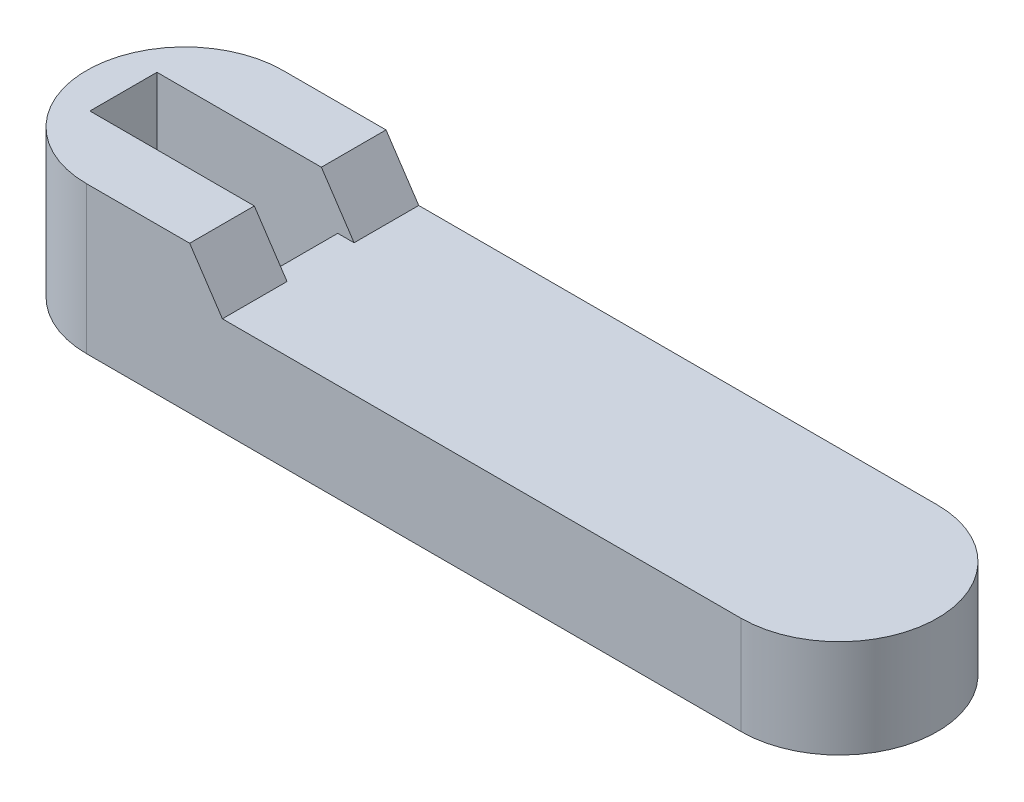
from build123d import *

# Parameters (mm, degrees)
BOSS_EXTRUDE1_DEPTH = 30
SKETCH2_R           = 7
CUT_EXTRUDE1_DEPTH  = 240.582971014
CUT_EXTRUDE2_DEPTH  = 28.5
BOSS_EXTRUDE2_DEPTH = 15
CUT_EXTRUDE3_DEPTH  = 242.919408068
CAVITY1_START       = -1
CAVITY1_OUTLINE_R   = 1.02
CAVITY1_DEPTH       = 5.98
CAVITY1_START_2     = 2.94
CAVITY1_2_OUTLINE_R = 1.683
CAVITY1_2_DEPTH     = 2.04
CAVITY1_START_3     = 4.98
CAVITY1_3_OUTLINE_R = 2.805
CAVITY1_3_DEPTH     = 1.02
SKETCH6_R           = 1.02
SKETCH6_R_2         = 5.61
CUT_EXTRUDE4_DEPTH  = 4.98
CUT_EXTRUDE5_START  = -1.02
SKETCH7_R           = 2.805
CUT_EXTRUDE5_DEPTH  = 1.02


with BuildPart() as part:
    # Sketch1 → Boss-Extrude1 (new body)
    with BuildSketch(Plane(origin=(0, 0, 0), x_dir=(1, 0, 0), z_dir=(0, 1, 0))):
        with BuildLine():
            Line((0, 0), (200, 0))
            ThreePointArc((200, 0), (230, 30), (200, 60))
            Line((200, 60), (0, 60))
            ThreePointArc((0, 60), (-30, 30), (0, 0))
        make_face()
    extrude(amount=BOSS_EXTRUDE1_DEPTH)

    # Sketch2 → Cut-Extrude1 (cut, through all)
    with BuildSketch(Plane(origin=(0, 30, 0), x_dir=(1, 0, 0), z_dir=(0, 1, 0))):
        with Locations(Location((0, 30, 0), (0, 0, 270))):
            Circle(SKETCH2_R)
    extrude(amount=-CUT_EXTRUDE1_DEPTH, mode=Mode.SUBTRACT)

    # Sketch3 → Cut-Extrude2 (cut)
    with BuildSketch(Plane(origin=(0, 30, 0), x_dir=(1, 0, 0), z_dir=(0, 1, 0))):
        Polygon((-18.75, 40.25), (-18.75, 19.75), (0, 19.75), (36.5, 19.75), (36.5, 40.25), (0, 40.25), align=None)
    extrude(amount=-CUT_EXTRUDE2_DEPTH, mode=Mode.SUBTRACT)

    # Sketch4 → Boss-Extrude2 (add)
    with BuildSketch(Plane(origin=(0, 30, 0), x_dir=(1, 0, 0), z_dir=(0, 1, 0))):
        with BuildLine():
            Line((-18.75, 40.25), (41.5, 40.25))
            Line((41.5, 40.25), (41.5, 60))
            Line((41.5, 60), (0, 60))
            ThreePointArc((0, 60), (-30, 30), (0, 0))
            Line((0, 0), (41.5, 0))
            Line((41.5, 0), (41.5, 19.75))
            Line((41.5, 19.75), (-18.75, 19.75))
            Line((-18.75, 19.75), (-18.75, 40.25))
        make_face()
    extrude(amount=BOSS_EXTRUDE2_DEPTH)

    # Sketch5 → Cut-Extrude3 (cut, through all)
    with BuildSketch(Plane.XY):
        Polygon((31.5, 45), (41.5, 45), (41.5, 30), align=None)
    extrude(amount=-CUT_EXTRUDE3_DEPTH, mode=Mode.SUBTRACT)

    # Cavity1: read off the stored shape, not the designer's step
    # Cavity1 outline → Cavity1 (cut)
    with BuildSketch(Plane(origin=(0, 0, 0), x_dir=(1, 0, 0), z_dir=(0, 1, 0)).offset(CAVITY1_START)):
        with BuildLine():
            Line((215.425139365, 48.931566971), (202.412835688, 39.121263561))
            ThreePointArc((202.412835688, 39.121263561), (200.117760104, 39.434265078), (197.815586916, 39.178647203))
            Line((197.815586916, 39.178647203), (185.052206965, 49.310687088))
            ThreePointArc((185.052206965, 49.310687088), (181.349681661, 49.121796309), (181.068433029, 45.425139365))
            Line((181.068433029, 45.425139365), (190.878736439, 32.412835688))
            ThreePointArc((190.878736439, 32.412835688), (190.565734922, 30.117760104), (190.821352797, 27.815586916))
            Line((190.821352797, 27.815586916), (180.689312912, 15.052206965))
            ThreePointArc((180.689312912, 15.052206965), (180.878203691, 11.349681661), (184.574860635, 11.068433029))
            Line((184.574860635, 11.068433029), (197.587164312, 20.878736439))
            ThreePointArc((197.587164312, 20.878736439), (199.882239896, 20.565734922), (202.184413084, 20.821352797))
            Line((202.184413084, 20.821352797), (214.947793035, 10.689312912))
            ThreePointArc((214.947793035, 10.689312912), (218.650318339, 10.878203691), (218.931566971, 14.574860635))
            Line((218.931566971, 14.574860635), (209.121263561, 27.587164312))
            ThreePointArc((209.121263561, 27.587164312), (209.434265078, 29.882239896), (209.178647203, 32.184413084))
            Line((209.178647203, 32.184413084), (219.310687088, 44.947793035))
            ThreePointArc((219.310687088, 44.947793035), (219.121796309, 48.650318339), (215.425139365, 48.931566971))
        make_face()
        with Locations((183.022971201, 13.441566555)):
            Circle(CAVITY1_OUTLINE_R, mode=Mode.SUBTRACT)
        with Locations((186.673945136, 17.002519984)):
            Circle(CAVITY1_OUTLINE_R, mode=Mode.SUBTRACT)
        with Locations((190.324919072, 20.563473413)):
            Circle(CAVITY1_OUTLINE_R, mode=Mode.SUBTRACT)
        with Locations((193.975893007, 24.124426842)):
            Circle(CAVITY1_OUTLINE_R, mode=Mode.SUBTRACT)
        with Locations((216.558433445, 13.022971201)):
            Circle(CAVITY1_OUTLINE_R, mode=Mode.SUBTRACT)
        with Locations((212.997480016, 16.673945136)):
            Circle(CAVITY1_OUTLINE_R, mode=Mode.SUBTRACT)
        with Locations((209.436526587, 20.324919072)):
            Circle(CAVITY1_OUTLINE_R, mode=Mode.SUBTRACT)
        with Locations((205.875573158, 23.975893007)):
            Circle(CAVITY1_OUTLINE_R, mode=Mode.SUBTRACT)
        with Locations((194.124426842, 36.024106993)):
            Circle(CAVITY1_OUTLINE_R, mode=Mode.SUBTRACT)
        with Locations((190.563473413, 39.675080928)):
            Circle(CAVITY1_OUTLINE_R, mode=Mode.SUBTRACT)
        with Locations((187.002519984, 43.326054864)):
            Circle(CAVITY1_OUTLINE_R, mode=Mode.SUBTRACT)
        with Locations((183.441566555, 46.977028799)):
            Circle(CAVITY1_OUTLINE_R, mode=Mode.SUBTRACT)
        with BuildLine():
            Line((202.58182093, 32.319782958), (203.124264185, 32.623999486))
            ThreePointArc((203.124264185, 32.623999486), (203.267629631, 32.443153003), (203.400540503, 32.254489806))
            Line((203.400540503, 32.254489806), (202.955317585, 31.82024456))
            Line((202.955317585, 31.82024456), (203.094251525, 31.572513843))
            Line((203.094251525, 31.572513843), (203.696948506, 31.725969798))
            ThreePointArc((203.696948506, 31.725969798), (203.788622379, 31.514179802), (203.868174794, 31.297545283))
            Line((203.868174794, 31.297545283), (203.325731539, 30.993328755))
            Line((203.325731539, 30.993328755), (203.395813992, 30.718080508))
            Line((203.395813992, 30.718080508), (204.017691895, 30.710318122))
            ThreePointArc((204.017691895, 30.710318122), (204.051426772, 30.48201775), (204.072199365, 30.252175193))
            Line((204.072199365, 30.252175193), (203.469502385, 30.098719237))
            Line((203.469502385, 30.098719237), (203.465957348, 29.814711173))
            Line((203.465957348, 29.814711173), (204.064636222, 29.646259439))
            ThreePointArc((204.064636222, 29.646259439), (204.038133126, 29.417006985), (203.99871028, 29.189619781))
            Line((203.99871028, 29.189619781), (203.376832377, 29.197382167))
            Line((203.376832377, 29.197382167), (203.299901438, 28.923968965))
            Line((203.299901438, 28.923968965), (203.834582307, 28.60630759))
            ThreePointArc((203.834582307, 28.60630759), (203.749647381, 28.391726231), (203.652715696, 28.182290441))
            Line((203.652715696, 28.182290441), (203.054036822, 28.350742175))
            Line((203.054036822, 28.350742175), (202.908962698, 28.106556495))
            Line((202.908962698, 28.106556495), (203.343207945, 27.661333577))
            ThreePointArc((203.343207945, 27.661333577), (203.205629364, 27.476046676), (203.057794575, 27.298835003))
            Line((203.057794575, 27.298835003), (202.523113706, 27.616496378))
            Line((202.523113706, 27.616496378), (202.319782958, 27.41817907))
            Line((202.319782958, 27.41817907), (202.623999486, 26.875735815))
            ThreePointArc((202.623999486, 26.875735815), (202.443153003, 26.732370369), (202.254489806, 26.599459497))
            Line((202.254489806, 26.599459497), (201.82024456, 27.044682415))
            Line((201.82024456, 27.044682415), (201.572513843, 26.905748475))
            Line((201.572513843, 26.905748475), (201.725969798, 26.303051494))
            ThreePointArc((201.725969798, 26.303051494), (201.514179802, 26.211377621), (201.297545283, 26.131825206))
            Line((201.297545283, 26.131825206), (200.993328755, 26.674268461))
            Line((200.993328755, 26.674268461), (200.718080508, 26.604186008))
            Line((200.718080508, 26.604186008), (200.710318122, 25.982308105))
            ThreePointArc((200.710318122, 25.982308105), (200.48201775, 25.948573228), (200.252175193, 25.927800635))
            Line((200.252175193, 25.927800635), (200.098719237, 26.530497615))
            Line((200.098719237, 26.530497615), (199.814711173, 26.534042652))
            Line((199.814711173, 26.534042652), (199.646259439, 25.935363778))
            ThreePointArc((199.646259439, 25.935363778), (199.417006985, 25.961866874), (199.189619781, 26.00128972))
            Line((199.189619781, 26.00128972), (199.197382167, 26.623167623))
            Line((199.197382167, 26.623167623), (198.923968965, 26.700098562))
            Line((198.923968965, 26.700098562), (198.60630759, 26.165417693))
            ThreePointArc((198.60630759, 26.165417693), (198.391726231, 26.250352619), (198.182290441, 26.347284304))
            Line((198.182290441, 26.347284304), (198.350742175, 26.945963178))
            Line((198.350742175, 26.945963178), (198.106556495, 27.091037302))
            Line((198.106556495, 27.091037302), (197.661333577, 26.656792055))
            ThreePointArc((197.661333577, 26.656792055), (197.476046676, 26.794370636), (197.298835003, 26.942205425))
            Line((197.298835003, 26.942205425), (197.616496378, 27.476886294))
            Line((197.616496378, 27.476886294), (197.41817907, 27.680217042))
            Line((197.41817907, 27.680217042), (196.875735815, 27.376000514))
            ThreePointArc((196.875735815, 27.376000514), (196.732370369, 27.556846997), (196.599459497, 27.745510194))
            Line((196.599459497, 27.745510194), (197.044682415, 28.17975544))
            Line((197.044682415, 28.17975544), (196.905748475, 28.427486157))
            Line((196.905748475, 28.427486157), (196.303051494, 28.274030202))
            ThreePointArc((196.303051494, 28.274030202), (196.211377621, 28.485820198), (196.131825206, 28.702454717))
            Line((196.131825206, 28.702454717), (196.674268461, 29.006671245))
            Line((196.674268461, 29.006671245), (196.604186008, 29.281919492))
            Line((196.604186008, 29.281919492), (195.982308105, 29.289681878))
            ThreePointArc((195.982308105, 29.289681878), (195.948573228, 29.51798225), (195.927800635, 29.747824807))
            Line((195.927800635, 29.747824807), (196.530497615, 29.901280763))
            Line((196.530497615, 29.901280763), (196.534042652, 30.185288827))
            Line((196.534042652, 30.185288827), (195.935363778, 30.353740561))
            ThreePointArc((195.935363778, 30.353740561), (195.961866874, 30.582993015), (196.00128972, 30.810380219))
            Line((196.00128972, 30.810380219), (196.623167623, 30.802617833))
            Line((196.623167623, 30.802617833), (196.700098562, 31.076031035))
            Line((196.700098562, 31.076031035), (196.165417693, 31.39369241))
            ThreePointArc((196.165417693, 31.39369241), (196.250352619, 31.608273769), (196.347284304, 31.817709559))
            Line((196.347284304, 31.817709559), (196.945963178, 31.649257825))
            Line((196.945963178, 31.649257825), (197.091037302, 31.893443505))
            Line((197.091037302, 31.893443505), (196.656792055, 32.338666423))
            ThreePointArc((196.656792055, 32.338666423), (196.794370636, 32.523953324), (196.942205425, 32.701164997))
            Line((196.942205425, 32.701164997), (197.476886294, 32.383503622))
            Line((197.476886294, 32.383503622), (197.680217042, 32.58182093))
            Line((197.680217042, 32.58182093), (197.376000514, 33.124264185))
            ThreePointArc((197.376000514, 33.124264185), (197.556846997, 33.267629631), (197.745510194, 33.400540503))
            Line((197.745510194, 33.400540503), (198.17975544, 32.955317585))
            Line((198.17975544, 32.955317585), (198.427486157, 33.094251525))
            Line((198.427486157, 33.094251525), (198.274030202, 33.696948506))
            ThreePointArc((198.274030202, 33.696948506), (198.485820198, 33.788622379), (198.702454717, 33.868174794))
            Line((198.702454717, 33.868174794), (199.006671245, 33.325731539))
            Line((199.006671245, 33.325731539), (199.281919492, 33.395813992))
            Line((199.281919492, 33.395813992), (199.289681878, 34.017691895))
            ThreePointArc((199.289681878, 34.017691895), (199.51798225, 34.051426772), (199.747824807, 34.072199365))
            Line((199.747824807, 34.072199365), (199.901280763, 33.469502385))
            Line((199.901280763, 33.469502385), (200.185288827, 33.465957348))
            Line((200.185288827, 33.465957348), (200.353740561, 34.064636222))
            ThreePointArc((200.353740561, 34.064636222), (200.582993015, 34.038133126), (200.810380219, 33.99871028))
            Line((200.810380219, 33.99871028), (200.802617833, 33.376832377))
            Line((200.802617833, 33.376832377), (201.076031035, 33.299901438))
            Line((201.076031035, 33.299901438), (201.39369241, 33.834582307))
            ThreePointArc((201.39369241, 33.834582307), (201.608273769, 33.749647381), (201.817709559, 33.652715696))
            Line((201.817709559, 33.652715696), (201.649257825, 33.054036822))
            Line((201.649257825, 33.054036822), (201.893443505, 32.908962698))
            Line((201.893443505, 32.908962698), (202.338666423, 33.343207945))
            ThreePointArc((202.338666423, 33.343207945), (202.523953324, 33.205629364), (202.701164997, 33.057794575))
            Line((202.701164997, 33.057794575), (202.383503622, 32.523113706))
            Line((202.383503622, 32.523113706), (202.58182093, 32.319782958))
        make_face(mode=Mode.SUBTRACT)
        with Locations((206.024106993, 35.875573158)):
            Circle(CAVITY1_OUTLINE_R, mode=Mode.SUBTRACT)
        with Locations((209.675080928, 39.436526587)):
            Circle(CAVITY1_OUTLINE_R, mode=Mode.SUBTRACT)
        with Locations((213.326054864, 42.997480016)):
            Circle(CAVITY1_OUTLINE_R, mode=Mode.SUBTRACT)
        with Locations((216.977028799, 46.558433445)):
            Circle(CAVITY1_OUTLINE_R, mode=Mode.SUBTRACT)
    extrude(amount=CAVITY1_DEPTH, mode=Mode.SUBTRACT)

    # Cavity1 2 outline → Cavity1 2 (cut)
    with BuildSketch(Plane(origin=(0, 0, 0), x_dir=(1, 0, 0), z_dir=(0, 1, 0)).offset(CAVITY1_START_2)):
        with BuildLine():
            ThreePointArc((203.400540503, 32.254489806), (203.267629631, 32.443153003), (203.124264185, 32.623999486))
            Line((203.124264185, 32.623999486), (202.58182093, 32.319782958))
            Line((202.58182093, 32.319782958), (202.383503622, 32.523113706))
            Line((202.383503622, 32.523113706), (202.701164997, 33.057794575))
            ThreePointArc((202.701164997, 33.057794575), (202.523953324, 33.205629364), (202.338666423, 33.343207945))
            Line((202.338666423, 33.343207945), (201.893443505, 32.908962698))
            Line((201.893443505, 32.908962698), (201.649257825, 33.054036822))
            Line((201.649257825, 33.054036822), (201.817709559, 33.652715696))
            ThreePointArc((201.817709559, 33.652715696), (201.608273769, 33.749647381), (201.39369241, 33.834582307))
            Line((201.39369241, 33.834582307), (201.076031035, 33.299901438))
            Line((201.076031035, 33.299901438), (200.802617833, 33.376832377))
            Line((200.802617833, 33.376832377), (200.810380219, 33.99871028))
            ThreePointArc((200.810380219, 33.99871028), (200.582993015, 34.038133126), (200.353740561, 34.064636222))
            Line((200.353740561, 34.064636222), (200.185288827, 33.465957348))
            Line((200.185288827, 33.465957348), (199.901280763, 33.469502385))
            Line((199.901280763, 33.469502385), (199.747824807, 34.072199365))
            ThreePointArc((199.747824807, 34.072199365), (199.51798225, 34.051426772), (199.289681878, 34.017691895))
            Line((199.289681878, 34.017691895), (199.281919492, 33.395813992))
            Line((199.281919492, 33.395813992), (199.006671245, 33.325731539))
            Line((199.006671245, 33.325731539), (198.702454717, 33.868174794))
            ThreePointArc((198.702454717, 33.868174794), (198.485820198, 33.788622379), (198.274030202, 33.696948506))
            Line((198.274030202, 33.696948506), (198.427486157, 33.094251525))
            Line((198.427486157, 33.094251525), (198.17975544, 32.955317585))
            Line((198.17975544, 32.955317585), (197.745510194, 33.400540503))
            ThreePointArc((197.745510194, 33.400540503), (197.556846997, 33.267629631), (197.376000514, 33.124264185))
            Line((197.376000514, 33.124264185), (197.680217042, 32.58182093))
            Line((197.680217042, 32.58182093), (197.476886294, 32.383503622))
            Line((197.476886294, 32.383503622), (196.942205425, 32.701164997))
            ThreePointArc((196.942205425, 32.701164997), (196.794370636, 32.523953324), (196.656792055, 32.338666423))
            Line((196.656792055, 32.338666423), (197.091037302, 31.893443505))
            Line((197.091037302, 31.893443505), (196.945963178, 31.649257825))
            Line((196.945963178, 31.649257825), (196.347284304, 31.817709559))
            ThreePointArc((196.347284304, 31.817709559), (196.250352619, 31.608273769), (196.165417693, 31.39369241))
            Line((196.165417693, 31.39369241), (196.700098562, 31.076031035))
            Line((196.700098562, 31.076031035), (196.623167623, 30.802617833))
            Line((196.623167623, 30.802617833), (196.00128972, 30.810380219))
            ThreePointArc((196.00128972, 30.810380219), (195.961866874, 30.582993015), (195.935363778, 30.353740561))
            Line((195.935363778, 30.353740561), (196.534042652, 30.185288827))
            Line((196.534042652, 30.185288827), (196.530497615, 29.901280763))
            Line((196.530497615, 29.901280763), (195.927800635, 29.747824807))
            ThreePointArc((195.927800635, 29.747824807), (195.948573228, 29.51798225), (195.982308105, 29.289681878))
            Line((195.982308105, 29.289681878), (196.604186008, 29.281919492))
            Line((196.604186008, 29.281919492), (196.674268461, 29.006671245))
            Line((196.674268461, 29.006671245), (196.131825206, 28.702454717))
            ThreePointArc((196.131825206, 28.702454717), (196.211377621, 28.485820198), (196.303051494, 28.274030202))
            Line((196.303051494, 28.274030202), (196.905748475, 28.427486157))
            Line((196.905748475, 28.427486157), (197.044682415, 28.17975544))
            Line((197.044682415, 28.17975544), (196.599459497, 27.745510194))
            ThreePointArc((196.599459497, 27.745510194), (196.732370369, 27.556846997), (196.875735815, 27.376000514))
            Line((196.875735815, 27.376000514), (197.41817907, 27.680217042))
            Line((197.41817907, 27.680217042), (197.616496378, 27.476886294))
            Line((197.616496378, 27.476886294), (197.298835003, 26.942205425))
            ThreePointArc((197.298835003, 26.942205425), (197.476046676, 26.794370636), (197.661333577, 26.656792055))
            Line((197.661333577, 26.656792055), (198.106556495, 27.091037302))
            Line((198.106556495, 27.091037302), (198.350742175, 26.945963178))
            Line((198.350742175, 26.945963178), (198.182290441, 26.347284304))
            ThreePointArc((198.182290441, 26.347284304), (198.391726231, 26.250352619), (198.60630759, 26.165417693))
            Line((198.60630759, 26.165417693), (198.923968965, 26.700098562))
            Line((198.923968965, 26.700098562), (199.197382167, 26.623167623))
            Line((199.197382167, 26.623167623), (199.189619781, 26.00128972))
            ThreePointArc((199.189619781, 26.00128972), (199.417006985, 25.961866874), (199.646259439, 25.935363778))
            Line((199.646259439, 25.935363778), (199.814711173, 26.534042652))
            Line((199.814711173, 26.534042652), (200.098719237, 26.530497615))
            Line((200.098719237, 26.530497615), (200.252175193, 25.927800635))
            ThreePointArc((200.252175193, 25.927800635), (200.48201775, 25.948573228), (200.710318122, 25.982308105))
            Line((200.710318122, 25.982308105), (200.718080508, 26.604186008))
            Line((200.718080508, 26.604186008), (200.993328755, 26.674268461))
            Line((200.993328755, 26.674268461), (201.297545283, 26.131825206))
            ThreePointArc((201.297545283, 26.131825206), (201.514179802, 26.211377621), (201.725969798, 26.303051494))
            Line((201.725969798, 26.303051494), (201.572513843, 26.905748475))
            Line((201.572513843, 26.905748475), (201.82024456, 27.044682415))
            Line((201.82024456, 27.044682415), (202.254489806, 26.599459497))
            ThreePointArc((202.254489806, 26.599459497), (202.443153003, 26.732370369), (202.623999486, 26.875735815))
            Line((202.623999486, 26.875735815), (202.319782958, 27.41817907))
            Line((202.319782958, 27.41817907), (202.523113706, 27.616496378))
            Line((202.523113706, 27.616496378), (203.057794575, 27.298835003))
            ThreePointArc((203.057794575, 27.298835003), (203.205629364, 27.476046676), (203.343207945, 27.661333577))
            Line((203.343207945, 27.661333577), (202.908962698, 28.106556495))
            Line((202.908962698, 28.106556495), (203.054036822, 28.350742175))
            Line((203.054036822, 28.350742175), (203.652715696, 28.182290441))
            ThreePointArc((203.652715696, 28.182290441), (203.749647381, 28.391726231), (203.834582307, 28.60630759))
            Line((203.834582307, 28.60630759), (203.299901438, 28.923968965))
            Line((203.299901438, 28.923968965), (203.376832377, 29.197382167))
            Line((203.376832377, 29.197382167), (203.99871028, 29.189619781))
            ThreePointArc((203.99871028, 29.189619781), (204.038133126, 29.417006985), (204.064636222, 29.646259439))
            Line((204.064636222, 29.646259439), (203.465957348, 29.814711173))
            Line((203.465957348, 29.814711173), (203.469502385, 30.098719237))
            Line((203.469502385, 30.098719237), (204.072199365, 30.252175193))
            ThreePointArc((204.072199365, 30.252175193), (204.051426772, 30.48201775), (204.017691895, 30.710318122))
            Line((204.017691895, 30.710318122), (203.395813992, 30.718080508))
            Line((203.395813992, 30.718080508), (203.325731539, 30.993328755))
            Line((203.325731539, 30.993328755), (203.868174794, 31.297545283))
            ThreePointArc((203.868174794, 31.297545283), (203.788622379, 31.514179802), (203.696948506, 31.725969798))
            Line((203.696948506, 31.725969798), (203.094251525, 31.572513843))
            Line((203.094251525, 31.572513843), (202.955317585, 31.82024456))
            Line((202.955317585, 31.82024456), (203.400540503, 32.254489806))
        make_face()
        with Locations((200, 30)):
            Circle(CAVITY1_2_OUTLINE_R, mode=Mode.SUBTRACT)
    extrude(amount=CAVITY1_2_DEPTH, mode=Mode.SUBTRACT)

    # Cavity1 3 outline → Cavity1 3 (cut)
    with BuildSketch(Plane(origin=(0, 0, 0), x_dir=(1, 0, 0), z_dir=(0, 1, 0)).offset(CAVITY1_START_3)):
        with BuildLine():
            ThreePointArc((203.400540503, 32.254489806), (203.267629631, 32.443153003), (203.124264185, 32.623999486))
            Line((203.124264185, 32.623999486), (202.58182093, 32.319782958))
            Line((202.58182093, 32.319782958), (202.383503622, 32.523113706))
            Line((202.383503622, 32.523113706), (202.701164997, 33.057794575))
            ThreePointArc((202.701164997, 33.057794575), (202.523953324, 33.205629364), (202.338666423, 33.343207945))
            Line((202.338666423, 33.343207945), (201.893443505, 32.908962698))
            Line((201.893443505, 32.908962698), (201.649257825, 33.054036822))
            Line((201.649257825, 33.054036822), (201.817709559, 33.652715696))
            ThreePointArc((201.817709559, 33.652715696), (201.608273769, 33.749647381), (201.39369241, 33.834582307))
            Line((201.39369241, 33.834582307), (201.076031035, 33.299901438))
            Line((201.076031035, 33.299901438), (200.802617833, 33.376832377))
            Line((200.802617833, 33.376832377), (200.810380219, 33.99871028))
            ThreePointArc((200.810380219, 33.99871028), (200.582993015, 34.038133126), (200.353740561, 34.064636222))
            Line((200.353740561, 34.064636222), (200.185288827, 33.465957348))
            Line((200.185288827, 33.465957348), (199.901280763, 33.469502385))
            Line((199.901280763, 33.469502385), (199.747824807, 34.072199365))
            ThreePointArc((199.747824807, 34.072199365), (199.51798225, 34.051426772), (199.289681878, 34.017691895))
            Line((199.289681878, 34.017691895), (199.281919492, 33.395813992))
            Line((199.281919492, 33.395813992), (199.006671245, 33.325731539))
            Line((199.006671245, 33.325731539), (198.702454717, 33.868174794))
            ThreePointArc((198.702454717, 33.868174794), (198.485820198, 33.788622379), (198.274030202, 33.696948506))
            Line((198.274030202, 33.696948506), (198.427486157, 33.094251525))
            Line((198.427486157, 33.094251525), (198.17975544, 32.955317585))
            Line((198.17975544, 32.955317585), (197.745510194, 33.400540503))
            ThreePointArc((197.745510194, 33.400540503), (197.556846997, 33.267629631), (197.376000514, 33.124264185))
            Line((197.376000514, 33.124264185), (197.680217042, 32.58182093))
            Line((197.680217042, 32.58182093), (197.476886294, 32.383503622))
            Line((197.476886294, 32.383503622), (196.942205425, 32.701164997))
            ThreePointArc((196.942205425, 32.701164997), (196.794370636, 32.523953324), (196.656792055, 32.338666423))
            Line((196.656792055, 32.338666423), (197.091037302, 31.893443505))
            Line((197.091037302, 31.893443505), (196.945963178, 31.649257825))
            Line((196.945963178, 31.649257825), (196.347284304, 31.817709559))
            ThreePointArc((196.347284304, 31.817709559), (196.250352619, 31.608273769), (196.165417693, 31.39369241))
            Line((196.165417693, 31.39369241), (196.700098562, 31.076031035))
            Line((196.700098562, 31.076031035), (196.623167623, 30.802617833))
            Line((196.623167623, 30.802617833), (196.00128972, 30.810380219))
            ThreePointArc((196.00128972, 30.810380219), (195.961866874, 30.582993015), (195.935363778, 30.353740561))
            Line((195.935363778, 30.353740561), (196.534042652, 30.185288827))
            Line((196.534042652, 30.185288827), (196.530497615, 29.901280763))
            Line((196.530497615, 29.901280763), (195.927800635, 29.747824807))
            ThreePointArc((195.927800635, 29.747824807), (195.948573228, 29.51798225), (195.982308105, 29.289681878))
            Line((195.982308105, 29.289681878), (196.604186008, 29.281919492))
            Line((196.604186008, 29.281919492), (196.674268461, 29.006671245))
            Line((196.674268461, 29.006671245), (196.131825206, 28.702454717))
            ThreePointArc((196.131825206, 28.702454717), (196.211377621, 28.485820198), (196.303051494, 28.274030202))
            Line((196.303051494, 28.274030202), (196.905748475, 28.427486157))
            Line((196.905748475, 28.427486157), (197.044682415, 28.17975544))
            Line((197.044682415, 28.17975544), (196.599459497, 27.745510194))
            ThreePointArc((196.599459497, 27.745510194), (196.732370369, 27.556846997), (196.875735815, 27.376000514))
            Line((196.875735815, 27.376000514), (197.41817907, 27.680217042))
            Line((197.41817907, 27.680217042), (197.616496378, 27.476886294))
            Line((197.616496378, 27.476886294), (197.298835003, 26.942205425))
            ThreePointArc((197.298835003, 26.942205425), (197.476046676, 26.794370636), (197.661333577, 26.656792055))
            Line((197.661333577, 26.656792055), (198.106556495, 27.091037302))
            Line((198.106556495, 27.091037302), (198.350742175, 26.945963178))
            Line((198.350742175, 26.945963178), (198.182290441, 26.347284304))
            ThreePointArc((198.182290441, 26.347284304), (198.391726231, 26.250352619), (198.60630759, 26.165417693))
            Line((198.60630759, 26.165417693), (198.923968965, 26.700098562))
            Line((198.923968965, 26.700098562), (199.197382167, 26.623167623))
            Line((199.197382167, 26.623167623), (199.189619781, 26.00128972))
            ThreePointArc((199.189619781, 26.00128972), (199.417006985, 25.961866874), (199.646259439, 25.935363778))
            Line((199.646259439, 25.935363778), (199.814711173, 26.534042652))
            Line((199.814711173, 26.534042652), (200.098719237, 26.530497615))
            Line((200.098719237, 26.530497615), (200.252175193, 25.927800635))
            ThreePointArc((200.252175193, 25.927800635), (200.48201775, 25.948573228), (200.710318122, 25.982308105))
            Line((200.710318122, 25.982308105), (200.718080508, 26.604186008))
            Line((200.718080508, 26.604186008), (200.993328755, 26.674268461))
            Line((200.993328755, 26.674268461), (201.297545283, 26.131825206))
            ThreePointArc((201.297545283, 26.131825206), (201.514179802, 26.211377621), (201.725969798, 26.303051494))
            Line((201.725969798, 26.303051494), (201.572513843, 26.905748475))
            Line((201.572513843, 26.905748475), (201.82024456, 27.044682415))
            Line((201.82024456, 27.044682415), (202.254489806, 26.599459497))
            ThreePointArc((202.254489806, 26.599459497), (202.443153003, 26.732370369), (202.623999486, 26.875735815))
            Line((202.623999486, 26.875735815), (202.319782958, 27.41817907))
            Line((202.319782958, 27.41817907), (202.523113706, 27.616496378))
            Line((202.523113706, 27.616496378), (203.057794575, 27.298835003))
            ThreePointArc((203.057794575, 27.298835003), (203.205629364, 27.476046676), (203.343207945, 27.661333577))
            Line((203.343207945, 27.661333577), (202.908962698, 28.106556495))
            Line((202.908962698, 28.106556495), (203.054036822, 28.350742175))
            Line((203.054036822, 28.350742175), (203.652715696, 28.182290441))
            ThreePointArc((203.652715696, 28.182290441), (203.749647381, 28.391726231), (203.834582307, 28.60630759))
            Line((203.834582307, 28.60630759), (203.299901438, 28.923968965))
            Line((203.299901438, 28.923968965), (203.376832377, 29.197382167))
            Line((203.376832377, 29.197382167), (203.99871028, 29.189619781))
            ThreePointArc((203.99871028, 29.189619781), (204.038133126, 29.417006985), (204.064636222, 29.646259439))
            Line((204.064636222, 29.646259439), (203.465957348, 29.814711173))
            Line((203.465957348, 29.814711173), (203.469502385, 30.098719237))
            Line((203.469502385, 30.098719237), (204.072199365, 30.252175193))
            ThreePointArc((204.072199365, 30.252175193), (204.051426772, 30.48201775), (204.017691895, 30.710318122))
            Line((204.017691895, 30.710318122), (203.395813992, 30.718080508))
            Line((203.395813992, 30.718080508), (203.325731539, 30.993328755))
            Line((203.325731539, 30.993328755), (203.868174794, 31.297545283))
            ThreePointArc((203.868174794, 31.297545283), (203.788622379, 31.514179802), (203.696948506, 31.725969798))
            Line((203.696948506, 31.725969798), (203.094251525, 31.572513843))
            Line((203.094251525, 31.572513843), (202.955317585, 31.82024456))
            Line((202.955317585, 31.82024456), (203.400540503, 32.254489806))
        make_face()
        with Locations((200, 30)):
            Circle(CAVITY1_3_OUTLINE_R, mode=Mode.SUBTRACT)
    extrude(amount=CAVITY1_3_DEPTH, mode=Mode.SUBTRACT)

    # Cavity1 4 outline → Cavity1 4 (revolve, cut)
    with BuildSketch(Plane(origin=(200, 0, -30), x_dir=(1, 0, 0), z_dir=(0, 0, 1))):
        Polygon((2.805, 6), (2.805, 4.98), (5.61, 4.98), (4.59, 6), align=None)
    revolve(axis=Axis((200, 0, -30), (0, 1, 0)), mode=Mode.SUBTRACT)

    # Sketch6 → Cut-Extrude4 (cut)
    with BuildSketch(Plane.XZ):
        with Locations((183.022971201, -13.441566555)):
            Circle(SKETCH6_R)
        with Locations((186.673945136, -17.002519984)):
            Circle(SKETCH6_R)
        with Locations((190.324919072, -20.563473413)):
            Circle(SKETCH6_R)
        with Locations((193.975893007, -24.124426842)):
            Circle(SKETCH6_R)
        with Locations((205.875573158, -23.975893007)):
            Circle(SKETCH6_R)
        with Locations((209.436526587, -20.324919072)):
            Circle(SKETCH6_R)
        with Locations((212.997480016, -16.673945136)):
            Circle(SKETCH6_R)
        with Locations((216.558433445, -13.022971201)):
            Circle(SKETCH6_R)
        with Locations((206.024106993, -35.875573158)):
            Circle(SKETCH6_R)
        with Locations((209.675080928, -39.436526587)):
            Circle(SKETCH6_R)
        with Locations((213.326054864, -42.997480016)):
            Circle(SKETCH6_R)
        with Locations((216.977028799, -46.558433445)):
            Circle(SKETCH6_R)
        with Locations((183.441566555, -46.977028799)):
            Circle(SKETCH6_R)
        with Locations((187.002519984, -43.326054864)):
            Circle(SKETCH6_R)
        with Locations((190.563473413, -39.675080928)):
            Circle(SKETCH6_R)
        with Locations((194.124426842, -36.024106993)):
            Circle(SKETCH6_R)
        with Locations((200, -30)):
            Circle(SKETCH6_R_2)
    extrude(amount=-CUT_EXTRUDE4_DEPTH, mode=Mode.SUBTRACT)

    # Sketch7 → Cut-Extrude5 (cut)
    with BuildSketch(Plane.XZ.offset(-4.98).offset(CUT_EXTRUDE5_START)):
        with Locations((200, -30)):
            Circle(SKETCH7_R)
    extrude(amount=CUT_EXTRUDE5_DEPTH, mode=Mode.SUBTRACT)


solid = part.part
